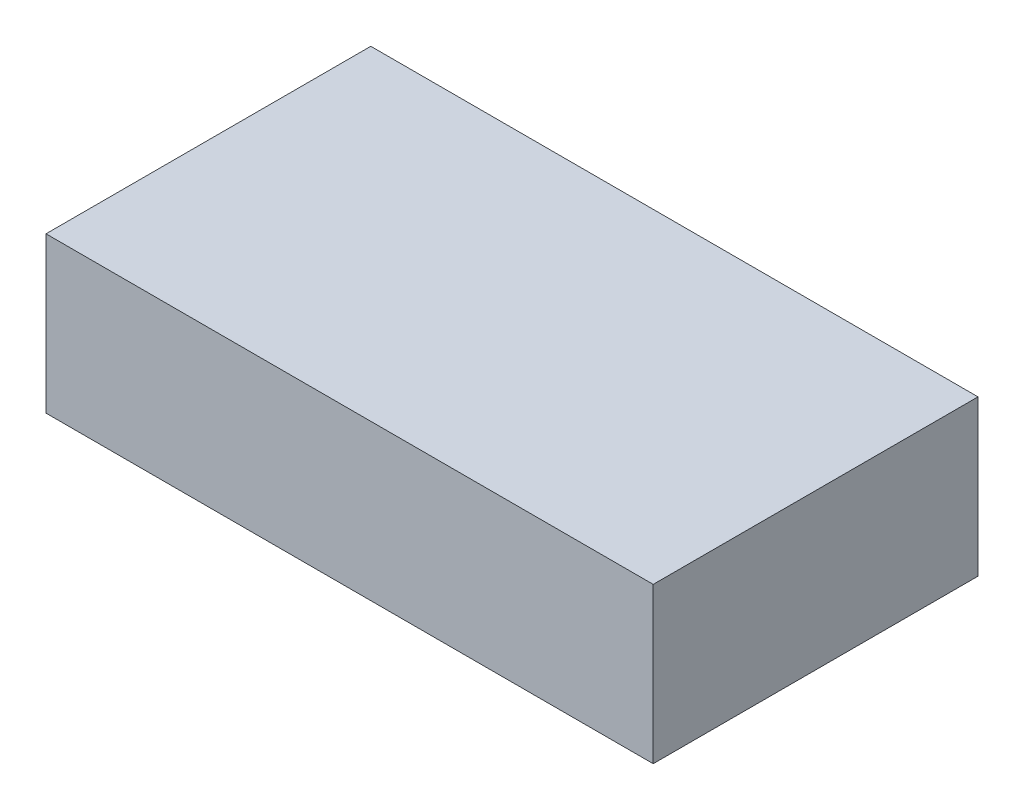
from build123d import *

# Parameters (mm, degrees)
SKETCH1_W           = 215
SKETCH1_H           = 115
BOSS_EXTRUDE1_DEPTH = 55


with BuildPart() as part:
    # Sketch1 → Boss-Extrude1 (new body)
    with BuildSketch(Plane(origin=(0, 0, 0), x_dir=(1, 0, 0), z_dir=(0, 1, 0))):
        Rectangle(SKETCH1_W, SKETCH1_H)
    extrude(amount=BOSS_EXTRUDE1_DEPTH)


solid = part.part
